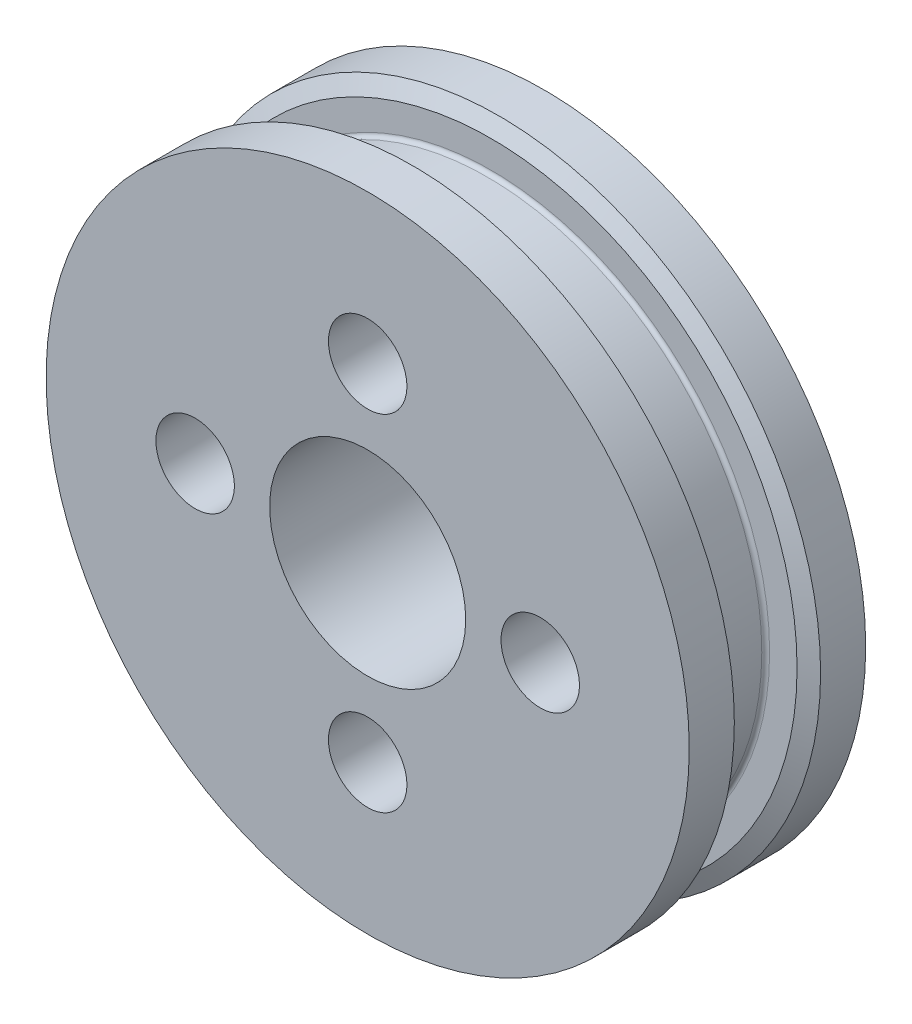
from build123d import *

# Parameters (mm, degrees)
SKETCH3_W               = 16.51
SKETCH3_H               = 16.51
SKETCH3_R               = 6.35
BOSS_EXTRUDE1_DEPTH     = 3.175
CUT_EXTRUDE1_DEPTH      = 32.595190583
CUT_EXTRUDE1_DEPTH_BACK = 32.595190583
SKETCH4_R               = 2.54
FILLET1_R               = 0.254


with BuildPart() as part:
    # Sketch2 → Revolve1 (revolve)
    with BuildSketch(Plane(origin=(0, 0, 0), x_dir=(0, 0, -1), z_dir=(1, 0, 0))):
        Polygon((0, 6.35), (0, 20.828), (2.921, 20.828), (3.429, 19.812), (3.429, 17.78), (8.001, 17.78), (8.001, 19.812), (8.509, 20.828), (11.43, 20.828), (11.43, 6.35), align=None)
    revolve(axis=Axis((0, 0, 0), (0, 0, -1)))

    # Sketch3 → Boss-Extrude1 (add)
    with BuildSketch(Plane(origin=(0, 0, -11.43), x_dir=(-1, 0, 0), z_dir=(0, 0, -1))):
        Rectangle(SKETCH3_W, SKETCH3_H)
        Circle(SKETCH3_R, mode=Mode.SUBTRACT)
    extrude(amount=BOSS_EXTRUDE1_DEPTH)

    # Sketch4 → Cut-Extrude1 (cut, two sides: drawn at the far end of the back side and taken through both)
    with BuildSketch(Plane(origin=(0, 0, -11.43), x_dir=(-1, 0, 0), z_dir=(0, 0, -1)).offset(-CUT_EXTRUDE1_DEPTH_BACK)):
        with Locations((0, 11.176)):
            Circle(SKETCH4_R)
        with Locations((11.176, 0)):
            Circle(SKETCH4_R)
        with Locations((0, -11.176)):
            Circle(SKETCH4_R)
        with Locations((-11.176, 0)):
            Circle(SKETCH4_R)
    extrude(amount=CUT_EXTRUDE1_DEPTH + CUT_EXTRUDE1_DEPTH_BACK, mode=Mode.SUBTRACT)

    # Fillet1
    fillet1_edges = [part.edges().sort_by_distance(p)[0] for p in [
        (0, -17.78, -8.001),
        (0, -17.78, -3.429),
    ]]
    fillet(fillet1_edges, radius=FILLET1_R)


solid = part.part
